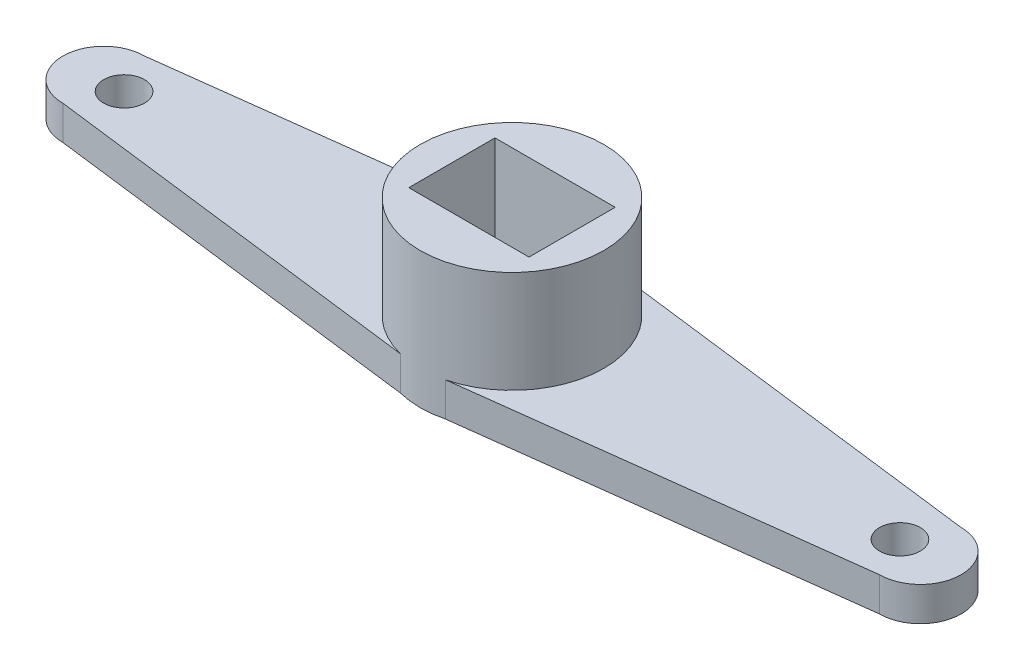
from build123d import *

# Parameters (mm, degrees)
SKETCH1_R           = 4.05
SKETCH1_W           = 5.3
SKETCH1_H           = 3.8
BOSS_EXTRUDE1_DEPTH = 6
BOSS_EXTRUDE2_DEPTH = 1.5
SKETCH3_R           = 0.9
SKETCH3_W           = 5.3
SKETCH3_H           = 3.8
CUT_EXTRUDE1_DEPTH  = 1.5


with BuildPart() as part:
    # Sketch1 → Boss-Extrude1 (new body)
    with BuildSketch(Plane(origin=(0, 0, 0), x_dir=(1, 0, 0), z_dir=(0, 1, 0))):
        Circle(SKETCH1_R)
        Rectangle(SKETCH1_W, SKETCH1_H, mode=Mode.SUBTRACT)
    extrude(amount=BOSS_EXTRUDE1_DEPTH)

    # Sketch2 → Boss-Extrude2 (add)
    with BuildSketch(Plane(origin=(0, 0, 0), x_dir=(1, 0, 0), z_dir=(0, 1, 0))):
        with BuildLine():
            Line((-18, 1.8), (0, 4.05))
            Line((0, 4.05), (18, 1.8))
            ThreePointArc((18, 1.8), (19.8, 0), (18, -1.8))
            Line((18, -1.8), (0, -4.05))
            Line((0, -4.05), (-18, -1.8))
            ThreePointArc((-18, -1.8), (-19.8, 0), (-18, 1.8))
        make_face()
    extrude(amount=BOSS_EXTRUDE2_DEPTH)

    # Sketch3 → Cut-Extrude1 (cut)
    with BuildSketch(Plane(origin=(0, 0, 0), x_dir=(1, 0, 0), z_dir=(0, 1, 0))):
        with Locations((-17.1, 0)):
            Circle(SKETCH3_R)
        with Locations((17.1, 0)):
            Circle(SKETCH3_R)
        Rectangle(SKETCH3_W, SKETCH3_H)
    extrude(amount=CUT_EXTRUDE1_DEPTH, mode=Mode.SUBTRACT)


solid = part.part
